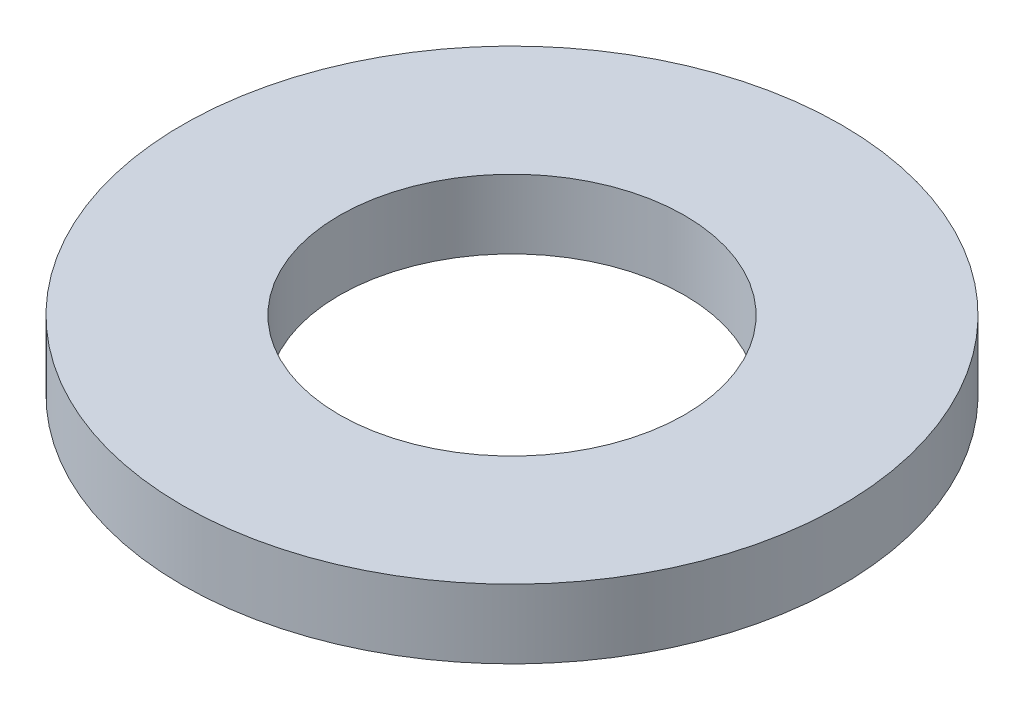
from build123d import *

# Parameters (mm, degrees)
SKETCH1_R           = 52.5
BOSS_EXTRUDE1_DEPTH = 11
SKETCH2_R           = 27.5
CUT_EXTRUDE1_DEPTH  = 76.056645275


with BuildPart() as part:
    # Sketch1 → Boss-Extrude1 (new body)
    with BuildSketch(Plane(origin=(0, 0, 0), x_dir=(1, 0, 0), z_dir=(0, 1, 0))):
        Circle(SKETCH1_R)
    extrude(amount=BOSS_EXTRUDE1_DEPTH)

    # Sketch2 → Cut-Extrude1 (cut, through all)
    with BuildSketch(Plane(origin=(0, 0, 0), x_dir=(1, 0, 0), z_dir=(0, 1, 0))):
        Circle(SKETCH2_R)
    extrude(amount=CUT_EXTRUDE1_DEPTH, mode=Mode.SUBTRACT)


solid = part.part
